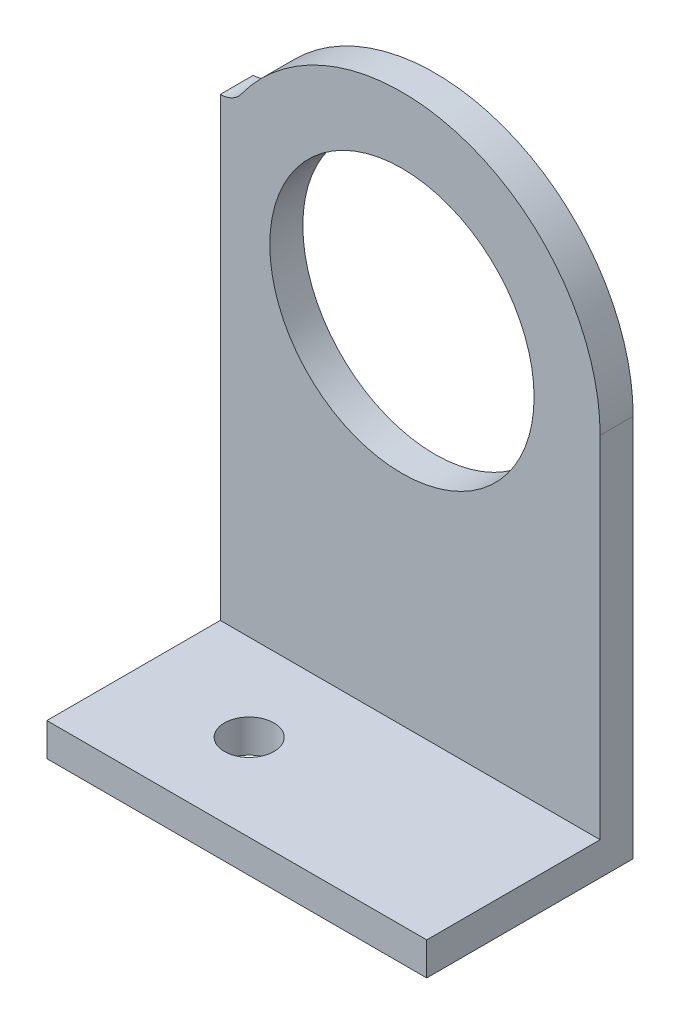
from build123d import *

# Parameters (mm, degrees)
SKETCH1_W               = 23
SKETCH1_H               = 12.5
BOSS_EXTRUDE1_DEPTH     = 2
SKETCH2_W               = 23
SKETCH2_H               = 33.206230298
BOSS_EXTRUDE2_DEPTH     = 2
SKETCH3_R               = 1.5
CUT_EXTRUDE1_DEPTH      = 2
SKETCH4_R               = 8
CUT_EXTRUDE2_DEPTH      = 2
CUT_EXTRUDE3_DEPTH      = 44.871729528
CUT_EXTRUDE3_DEPTH_BACK = 2


with BuildPart() as part:
    # Sketch1 → Boss-Extrude1 (new body)
    with BuildSketch(Plane(origin=(0, 0, 0), x_dir=(1, 0, 0), z_dir=(0, 1, 0))):
        with Locations((11.5, 6.25)):
            Rectangle(SKETCH1_W, SKETCH1_H)
    extrude(amount=BOSS_EXTRUDE1_DEPTH)

    # Sketch2 → Boss-Extrude2 (add)
    with BuildSketch(Plane(origin=(0, 0, -12.5), x_dir=(-1, 0, 0), z_dir=(0, 0, -1))):
        with Locations((-11.5, 18.603115149)):
            Rectangle(SKETCH2_W, SKETCH2_H)
    extrude(amount=-BOSS_EXTRUDE2_DEPTH)

    # Sketch3 → Cut-Extrude1 (cut)
    with BuildSketch(Plane(origin=(0, 2, 0), x_dir=(1, 0, 0), z_dir=(0, 1, 0))):
        with Locations((7, 5.25)):
            Circle(SKETCH3_R)
    extrude(amount=-CUT_EXTRUDE1_DEPTH, mode=Mode.SUBTRACT)

    # Sketch4 → Cut-Extrude2 (cut)
    with BuildSketch(Plane(origin=(0, 0, -12.5), x_dir=(-1, 0, 0), z_dir=(0, 0, -1))):
        with Locations((-11, 23.206230298)):
            Circle(SKETCH4_R)
    extrude(amount=-CUT_EXTRUDE2_DEPTH, mode=Mode.SUBTRACT)

    # Sketch6 → Cut-Extrude3 (cut, two sides: drawn at the far end of the back side and taken through both)
    with BuildSketch(Plane(origin=(0, 0, -12.5), x_dir=(-1, 0, 0), z_dir=(0, 0, -1)).offset(-CUT_EXTRUDE3_DEPTH_BACK)):
        with BuildLine():
            Line((-23, -61.737420213), (-23, 23.206230298))
            ThreePointArc((-23, 23.206230298), (-14.692788513, 34.623905762), (-1.272781167, 30.233407097))
            ThreePointArc((-1.272781167, 30.233407097), (-0.714730292, 29.754828233), (0, 29.582726176))
            Line((0, 29.582726176), (84.943650511, 29.582726176))
            Line((84.943650511, 29.582726176), (-24.781977419, 159.282308379))
            Line((-24.781977419, 159.282308379), (-132.72562793, 67.962161991))
            Line((-132.72562793, 67.962161991), (-23, -61.737420213))
        make_face()
    extrude(amount=CUT_EXTRUDE3_DEPTH + CUT_EXTRUDE3_DEPTH_BACK, mode=Mode.SUBTRACT)


solid = part.part
